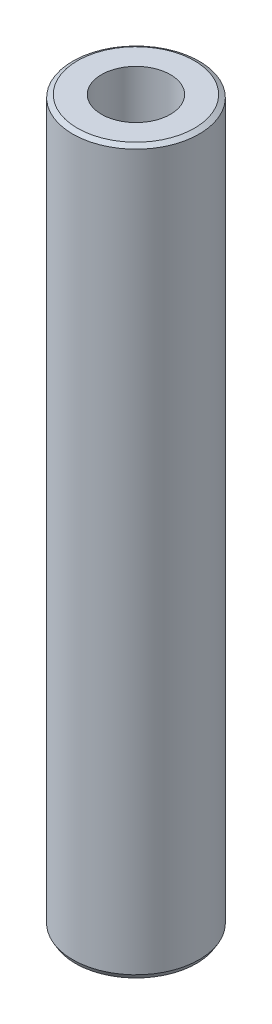
from build123d import *
from OCP.BRepFilletAPI import BRepFilletAPI_MakeChamfer

# Parameters (mm, degrees)
SKETCH1_R           = 52.5
BOSS_EXTRUDE1_DEPTH = 600
SKETCH2_R           = 28.617725331
CUT_EXTRUDE1_DEPTH  = 605.576297914
CHAMFER1_SIZE       = 2.257415864
CHAMFER1_SIZE2      = 3.90995897


with BuildPart() as part:
    # Sketch1 → Boss-Extrude1 (new body)
    with BuildSketch(Plane(origin=(0, 0, 0), x_dir=(1, 0, 0), z_dir=(0, 1, 0))):
        Circle(SKETCH1_R)
    extrude(amount=BOSS_EXTRUDE1_DEPTH)

    # Sketch2 → Cut-Extrude1 (cut, through all)
    with BuildSketch(Plane(origin=(0, 0, 0), x_dir=(1, 0, 0), z_dir=(0, 1, 0))):
        Circle(SKETCH2_R)
    extrude(amount=CUT_EXTRUDE1_DEPTH, mode=Mode.SUBTRACT)

    # Chamfer1: one chamfer whose edges measure the first distance from different faces: ONE call of the kernel's chamfer builder (chamfer() names one face for all edges)
    chamfer1_edges_1 = [part.edges().sort_by_distance(p)[0] for p in [
        (-52.5, 600, 0),
    ]]
    chamfer1_side_1 = [part.faces().sort_by_distance(p)[0] for p in [
        (-52.5, 300, 0),
    ]]
    chamfer1_edges_2 = [part.edges().sort_by_distance(p)[0] for p in [
        (-52.5, 0, 0),
    ]]
    chamfer1_side_2 = [part.faces().sort_by_distance(p)[0] for p in [
        (-51.01507576, 0, 0),
    ]]
    chamfer1 = BRepFilletAPI_MakeChamfer(part.part.solid().wrapped)
    for e in chamfer1_edges_1:
        chamfer1.Add(CHAMFER1_SIZE, CHAMFER1_SIZE2, e.wrapped, chamfer1_side_1[0].wrapped)  # the first distance lies on this face
    for e in chamfer1_edges_2:
        chamfer1.Add(CHAMFER1_SIZE, CHAMFER1_SIZE2, e.wrapped, chamfer1_side_2[0].wrapped)  # the first distance lies on this face
    add(Compound.cast(chamfer1.Shape()), mode=Mode.REPLACE)


solid = part.part
